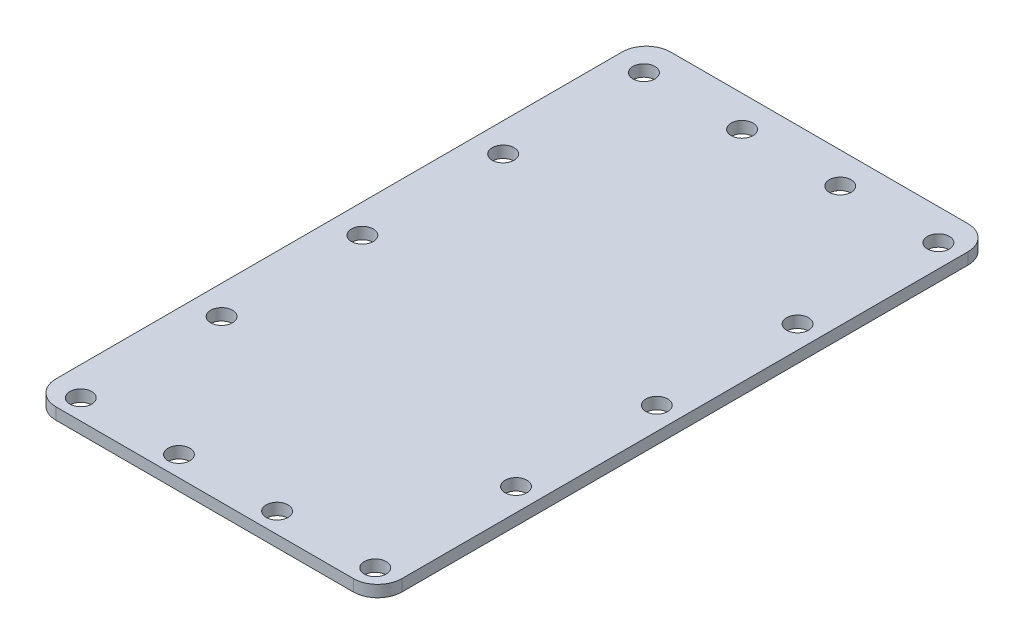
from build123d import *

# Parameters (mm, degrees)
ESBO_O1_R          = 4.5
FLANGE_BASE1_DEPTH = 4.8


# Sheet-metal steps are written as plain solids
with BuildPart() as part:
    # Esboço1 → Flange-base1 (new body)
    with BuildSketch(Plane(origin=(0, 0, 0), x_dir=(1, 0, 0), z_dir=(0, 1, 0))):
        with BuildLine():
            Line((-61.2, -126.5), (61.2, -126.5))
            ThreePointArc((61.2, -126.5), (68.271067812, -123.571067812), (71.2, -116.5))
            Line((71.2, -116.5), (71.2, 116.5))
            ThreePointArc((71.2, 116.5), (68.271067812, 123.571067812), (61.2, 126.5))
            Line((61.2, 126.5), (-61.2, 126.5))
            ThreePointArc((-61.2, 126.5), (-68.271067812, 123.571067812), (-71.2, 116.5))
            Line((-71.2, 116.5), (-71.2, -116.5))
            ThreePointArc((-71.2, -116.5), (-68.271067812, -123.571067812), (-61.2, -126.5))
        make_face()
        with Locations(Location((-59.32366364, 113.632351832, 0), (0, 0, 270))):
            Circle(ESBO_O1_R, mode=Mode.SUBTRACT)
        with Locations(Location((61.87633636, 113.632351832, 0), (0, 0, 270))):
            Circle(ESBO_O1_R, mode=Mode.SUBTRACT)
        with Locations(Location((-59.32366364, -118.167648168, 0), (0, 0, 270))):
            Circle(ESBO_O1_R, mode=Mode.SUBTRACT)
        with Locations(Location((61.87633636, -118.167648168, 0), (0, 0, 270))):
            Circle(ESBO_O1_R, mode=Mode.SUBTRACT)
        with Locations(Location((-18.92366364, 113.632351832, 0), (0, 0, 270))):
            Circle(ESBO_O1_R, mode=Mode.SUBTRACT)
        with Locations(Location((21.47633636, 113.632351832, 0), (0, 0, 270))):
            Circle(ESBO_O1_R, mode=Mode.SUBTRACT)
        with Locations(Location((61.87633636, 55.682351832, 0), (0, 0, 270))):
            Circle(ESBO_O1_R, mode=Mode.SUBTRACT)
        with Locations(Location((61.87633636, -2.267648168, 0), (0, 0, 270))):
            Circle(ESBO_O1_R, mode=Mode.SUBTRACT)
        with Locations(Location((61.87633636, -60.217648168, 0), (0, 0, 270))):
            Circle(ESBO_O1_R, mode=Mode.SUBTRACT)
        with Locations(Location((21.47633636, -118.167648168, 0), (0, 0, 90))):
            Circle(ESBO_O1_R, mode=Mode.SUBTRACT)
        with Locations(Location((-18.92366364, -118.167648168, 0), (0, 0, 90))):
            Circle(ESBO_O1_R, mode=Mode.SUBTRACT)
        with Locations(Location((-59.32366364, -60.217648168, 0), (0, 0, 90))):
            Circle(ESBO_O1_R, mode=Mode.SUBTRACT)
        with Locations(Location((-59.32366364, -2.267648168, 0), (0, 0, 90))):
            Circle(ESBO_O1_R, mode=Mode.SUBTRACT)
        with Locations(Location((-59.32366364, 55.682351832, 0), (0, 0, 90))):
            Circle(ESBO_O1_R, mode=Mode.SUBTRACT)
    extrude(amount=-FLANGE_BASE1_DEPTH)


solid = part.part
